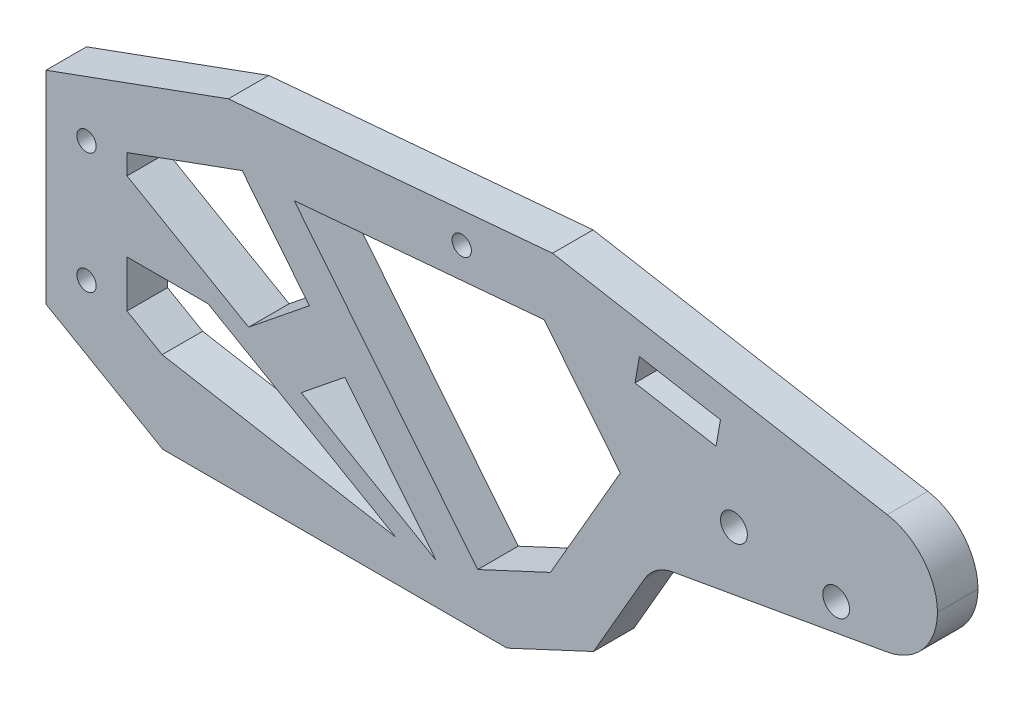
from build123d import *

# Parameters (mm, degrees)
ESQUISSE1_W                             = 220
ESQUISSE1_H                             = 90
BOSS_EXTRU_1_DEPTH                      = 10
ESQUISSE2_OUTSIDE_W                     = 269.582
ESQUISSE2_OUTSIDE_H                     = 139.582
ENL_V_MAT_EXTRU_1_DEPTH                 = 238.907545067
ENL_V_MAT_EXTRU_2_DEPTH                 = 238.907545067
CONG_1_R                                = 15
ESQUISSE4_R                             = 3.305
ENL_V_MAT_EXTRU_3_DEPTH                 = 238.90731446
PER_AGE_POUR_CROUS_AUTO_BLOQUANTS_300_D = 4.7625
PER_AGE_POUR_CROUS_AUTO_BLOQUANTS_3_2_D = 4.7625
ENL_V_MAT_EXTRU_4_DEPTH                 = 10
CONG_2_R                                = 10


with BuildPart() as part:
    # Esquisse1 → Boss.-Extru.1 (new body)
    with BuildSketch(Plane.XY):
        with Locations((110, 45)):
            Rectangle(ESQUISSE1_W, ESQUISSE1_H)
    extrude(amount=BOSS_EXTRU_1_DEPTH)

    # Esquisse2 outside → Enlèv. mat.-Extru.1 (cut, through all)
    with BuildSketch(Plane.XY.offset(10)):
        with Locations((110, 45)):
            Rectangle(ESQUISSE2_OUTSIDE_W, ESQUISSE2_OUTSIDE_H)
        Polygon((220, 73.248936833), (125, 90), (45, 83.000906918), (0, 66.622246376), (0, 16.622246376), (28.790575259, 0), (113.790575259, 0), (135.121280108, 9.946671025), (150.121280108, 35.927433138), (220, 48.248936833), align=None, mode=Mode.SUBTRACT)
    extrude(amount=-ENL_V_MAT_EXTRU_1_DEPTH, mode=Mode.SUBTRACT)

    # Esquisse3 → Enlèv. mat.-Extru.2 (cut, through all)
    with BuildSketch(Plane.XY.offset(10)):
        Polygon((124.495639968, 21.542522439), (141.732730573, 51.398039143), (122.912069568, 74.760032194), (61.263110797, 69.366447183), (106.536954459, 13.168249856), align=None)
        Polygon((96.247958869, 10), (73.776753989, 37.893395035), (62.988565413, 29.202319765), align=None)
        Polygon((20, 25.154266119), (20, 36.701271503), (40, 36.701271503), (86.247958869, 10), (28.660254038, 20.154266119), align=None)
        Polygon((20, 54.021779578), (49.998184356, 36.702319765), (65, 48.78793618), (48.421740656, 69.366447183), (20, 59.021779578), align=None)
    extrude(amount=-ENL_V_MAT_EXTRU_2_DEPTH, mode=Mode.SUBTRACT)

    # Congé1
    # the kernel refuses this fillet: 15 mm, written as the material it takes off along each edge
    with BuildSketch(Plane(origin=(220, 73.248936833, 41.466236169), x_dir=(-0.9848077530122094, 0.17364817766692334, 0), z_dir=(0, 0, -1))) as cong_1_piece_1:
        with BuildLine():
            CenterArc((CONG_1_R * 0.839099631177, -CONG_1_R), CONG_1_R, 90, 80)
            Line((-CONG_1_R * 0.145708121835, -CONG_1_R * 0.826351822333), (0, 0))
            Line((0, 0), (CONG_1_R * 0.839099631177, 0))
        make_face()
    extrude(amount=72.932472338, mode=Mode.SUBTRACT)
    with BuildSketch(Plane(origin=(220, 48.248936833, 41.466236169), x_dir=(-0.9848077530122079, -0.17364817766693147, 0), z_dir=(0, 0, -1))) as cong_1_piece_2:
        with BuildLine():
            CenterArc((CONG_1_R * 0.839099631177, CONG_1_R), CONG_1_R, 190, 80)
            Line((-CONG_1_R * 0.145708121835, CONG_1_R * 0.826351822333), (0, 0))
            Line((0, 0), (CONG_1_R * 0.839099631177, 0))
        make_face()
    extrude(amount=72.932472338, mode=Mode.SUBTRACT)

    # Esquisse4 → Enlèv. mat.-Extru.3 (cut, through all)
    with BuildSketch(Plane.XY.offset(10)):
        with Locations((194.999750621, 50.537155323)):
            Circle(ESQUISSE4_R)
        with Locations((169.766644599, 53.836955846)):
            Circle(ESQUISSE4_R)
    extrude(amount=-ENL_V_MAT_EXTRU_3_DEPTH, mode=Mode.SUBTRACT)

    # Per_age pour _crous auto-bloquants 300 (through all)
    with Locations(Plane.XY.offset(10)):
        with Locations((102.584612496, 80.510258923)):
            Hole(PER_AGE_POUR_CROUS_AUTO_BLOQUANTS_300_D / 2)

    # Per_age pour _crous auto-bloquants 3 2 (through all)
    with Locations(Plane.XY.offset(10)):
        with Locations((10, 56.521779578), (10, 26.722713174)):
            Hole(PER_AGE_POUR_CROUS_AUTO_BLOQUANTS_3_2_D / 2)

    # Esquisse10 → Enlèv. mat.-Extru.4 (cut)
    with BuildSketch(Plane.XY.offset(10)):
        Polygon((146.450960741, 78.662842867), (145.356977222, 72.458554023), (165.348574608, 68.933496016), (166.442558127, 75.13778486), align=None)
    extrude(amount=-ENL_V_MAT_EXTRU_4_DEPTH, mode=Mode.SUBTRACT)

    # Congé2
    cong_2_edges = [part.edges().sort_by_distance(p)[0] for p in [
        (150.121280108, 35.927433138, 5),
    ]]
    fillet(cong_2_edges, radius=CONG_2_R)


solid = part.part
